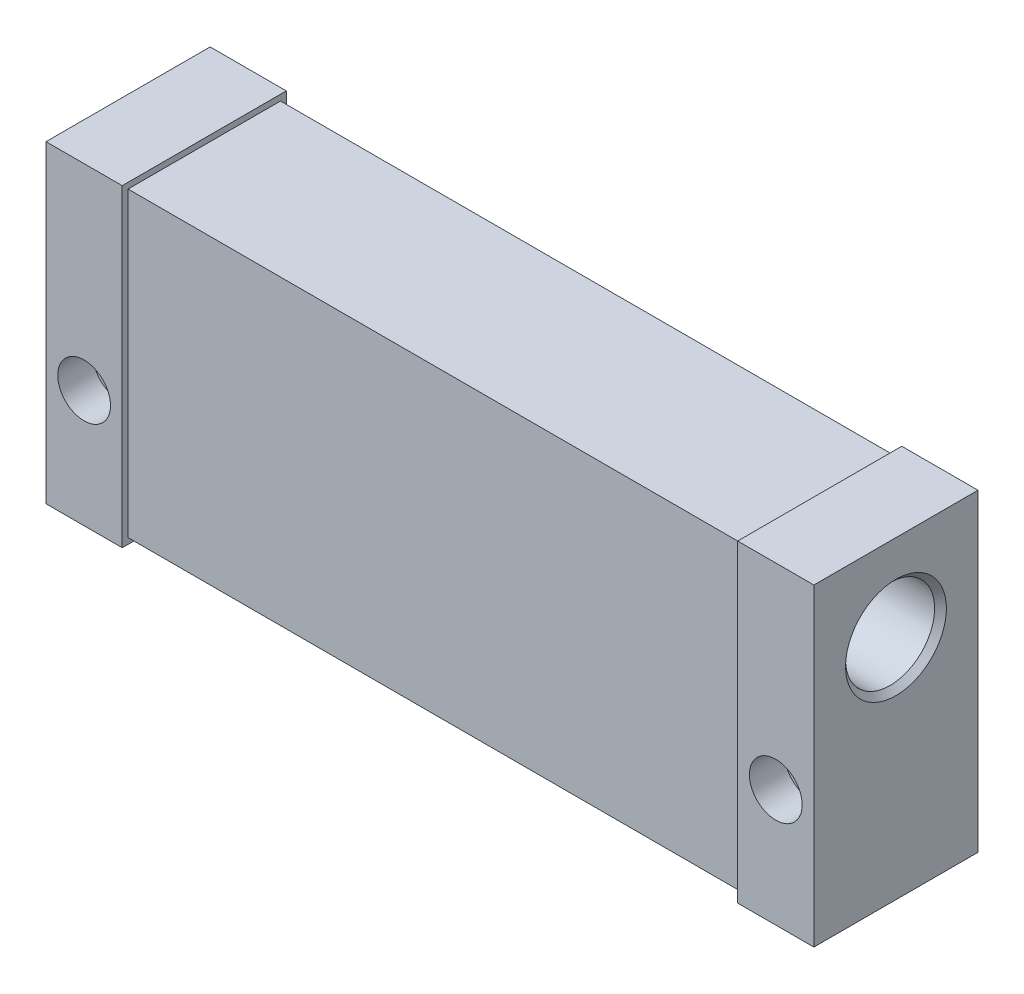
from build123d import *

# Parameters (mm, degrees)
SKETCH1_W                               = 131
SKETCH1_H                               = 53.5
EXTRUDE1_DEPTH                          = 14
CUT_SWEEP1_START                        = -14
CUT_SWEEP1_OUTLINE_W                    = 105
CUT_SWEEP1_OUTLINE_H                    = 1
CUT_SWEEP1_DEPTH                        = 28
CUT_SWEEP1_2_OUTLINE_W                  = 105
CUT_SWEEP1_2_OUTLINE_H                  = 51.5
CUT_SWEEP1_2_DEPTH                      = 1
CUT_SWEEP1_START_2                      = 13
CUT_SWEEP1_3_OUTLINE_W                  = 105
CUT_SWEEP1_3_OUTLINE_H                  = 51.5
CUT_SWEEP1_3_DEPTH                      = 1
SKETCH3_R                               = 7.6
CUT_EXTRUDE1_DEPTH                      = 135.434231132
CBORE_FOR_M5_HEX_HEAD_BOLT1_D           = 5.5
CBORE_FOR_M5_HEX_HEAD_BOLT1_CBORE_D     = 9
CBORE_FOR_M5_HEX_HEAD_BOLT1_CBORE_DEPTH = 6
CHAMFER1_SIZE                           = 1
M5X0_8_TAPPED_HOLE1_D                   = 4.2
M5X0_8_TAPPED_HOLE1_DEPTH               = 12.4
M5X0_8_TAPPED_HOLE1_TIP                 = 1.2618073


# Read off the part's stored shape, not the designer's step: Cut-Sweep1
with BuildPart() as part:
    # Sketch1 → Extrude1 (new, symmetric)
    with BuildSketch(Plane.XY):
        Rectangle(SKETCH1_W, SKETCH1_H)
    extrude(amount=EXTRUDE1_DEPTH, both=True)

    # Cut-Sweep1 outline → Cut-Sweep1 (cut)
    with BuildSketch(Plane.XY.offset(CUT_SWEEP1_START)):
        with Locations((0, -26.25)):
            Rectangle(CUT_SWEEP1_OUTLINE_W, CUT_SWEEP1_OUTLINE_H)
        with Locations((0, 26.25)):
            Rectangle(CUT_SWEEP1_OUTLINE_W, CUT_SWEEP1_OUTLINE_H)
    extrude(amount=CUT_SWEEP1_DEPTH, mode=Mode.SUBTRACT)

    # Cut-Sweep1 2 outline → Cut-Sweep1 2 (cut)
    with BuildSketch(Plane.XY.offset(CUT_SWEEP1_START)):
        Rectangle(CUT_SWEEP1_2_OUTLINE_W, CUT_SWEEP1_2_OUTLINE_H)
    extrude(amount=CUT_SWEEP1_2_DEPTH, mode=Mode.SUBTRACT)

    # Cut-Sweep1 3 outline → Cut-Sweep1 3 (cut)
    with BuildSketch(Plane.XY.offset(CUT_SWEEP1_START_2)):
        Rectangle(CUT_SWEEP1_3_OUTLINE_W, CUT_SWEEP1_3_OUTLINE_H)
    extrude(amount=CUT_SWEEP1_3_DEPTH, mode=Mode.SUBTRACT)

    # Sketch3 → Cut-Extrude1 (cut, through all)
    with BuildSketch(Plane.ZY.offset(65.5)):
        with Locations(Location((0, 12, 0), (0, 0, 270))):
            Circle(SKETCH3_R)
    extrude(amount=-CUT_EXTRUDE1_DEPTH, mode=Mode.SUBTRACT)

    # CBORE for M5 Hex Head Bolt1 (through all)
    with Locations(Plane(origin=(-59, -6.75, 14), x_dir=(1, 0, 0), z_dir=(0, 0, 1))):
        with Locations((0, 0), (118, 0)):
            CounterBoreHole(CBORE_FOR_M5_HEX_HEAD_BOLT1_D / 2, CBORE_FOR_M5_HEX_HEAD_BOLT1_CBORE_D / 2, CBORE_FOR_M5_HEX_HEAD_BOLT1_CBORE_DEPTH)

    # Chamfer1
    chamfer1_edges = [part.edges().sort_by_distance(p)[0] for p in [
        (65.5, 19.6, 0),
        (-65.5, 19.6, 0),
    ]]
    chamfer(chamfer1_edges, length=CHAMFER1_SIZE)

    # M5x0.8 Tapped Hole1
    with Locations(Plane(origin=(-59, -26.75, -3), x_dir=(0, 0, -1), z_dir=(0, -1, 0))):
        with Locations((0, 0), (0, 118.655251347)):
            Hole(M5X0_8_TAPPED_HOLE1_D / 2, depth=M5X0_8_TAPPED_HOLE1_DEPTH)
            with Locations((0, 0, -(M5X0_8_TAPPED_HOLE1_DEPTH + M5X0_8_TAPPED_HOLE1_TIP / 2))):  # 118° drill point
                Cone(0, M5X0_8_TAPPED_HOLE1_D / 2, M5X0_8_TAPPED_HOLE1_TIP, mode=Mode.SUBTRACT)


solid = part.part
